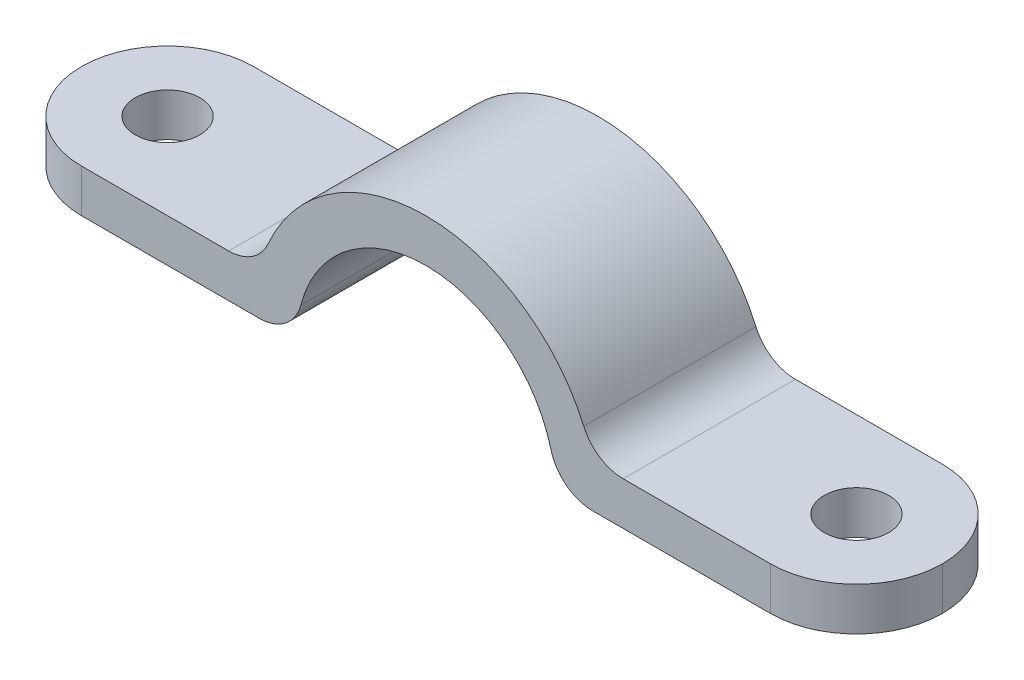
from build123d import *

# Parameters (mm, degrees)
BOSS_EXTRUDE1_DEPTH = 40
FILLET1_R           = 20
SKETCH2_R           = 7.5
CUT_EXTRUDE1_DEPTH  = 40


with BuildPart() as part:
    # Sketch1 → Boss-Extrude1 (new body)
    with BuildSketch(Plane.XY):
        with BuildLine():
            Line((-100, 0), (-38.729833462, 0))
            ThreePointArc((-38.729833462, 0), (-32.606109105, 2.09430585), (-29.047375097, 7.5))
            ThreePointArc((-29.047375097, 7.5), (0, 30), (29.047375097, 7.5))
            ThreePointArc((29.047375097, 7.5), (32.606109105, 2.09430585), (38.729833462, 0))
            Line((38.729833462, 0), (100, 0))
            Line((100, 0), (100, 10))
            Line((100, 10), (45.82575695, 10))
            ThreePointArc((45.82575695, 10), (40.348531375, 11.633399735), (36.66060556, 16))
            ThreePointArc((36.66060556, 16), (0, 40), (-36.66060556, 16))
            ThreePointArc((-36.66060556, 16), (-40.348531375, 11.633399735), (-45.82575695, 10))
            Line((-45.82575695, 10), (-100, 10))
            Line((-100, 10), (-100, 0))
        make_face()
    extrude(amount=BOSS_EXTRUDE1_DEPTH)

    # Fillet1
    fillet1_edges = [part.edges().sort_by_distance(p)[0] for p in [
        (100, 5, 0),
        (100, 5, 40),
        (-100, 5, 0),
        (-100, 5, 40),
    ]]
    fillet(fillet1_edges, radius=FILLET1_R - 0.0001)  # a hair under: the kernel refuses the full size

    # Sketch2 → Cut-Extrude1 (cut)
    with BuildSketch(Plane(origin=(0, 10, 0), x_dir=(1, 0, 0), z_dir=(0, 1, 0))):
        with Locations(Location((-80, -20, 0), (0, 0, 270))):
            Circle(SKETCH2_R)
        with Locations(Location((80, -20, 0), (0, 0, 270))):
            Circle(SKETCH2_R)
    extrude(amount=-CUT_EXTRUDE1_DEPTH, mode=Mode.SUBTRACT)


solid = part.part
